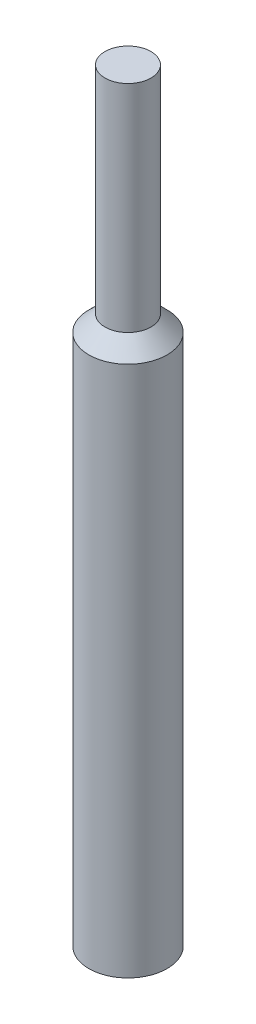
from build123d import *

# Parameters (mm, degrees)
SKETCH1_R           = 6.35
BOSS_EXTRUDE1_DEPTH = 421.64
SKETCH2_R           = 10.795
BOSS_EXTRUDE2_DEPTH = 421.64
SKETCH3_R           = 25.4
SKETCH3_R_2         = 6.35
CUT_EXTRUDE1_DEPTH  = 52.324
CUT_EXTRUDE2_START  = -57.658
SKETCH4_R           = 25.4
SKETCH4_R_2         = 6.35
CUT_EXTRUDE2_DEPTH  = 57.658
CHAMFER1_SIZE       = 6.35
SKETCH5_R           = 15.875
CUT_EXTRUDE3_DEPTH  = 212.372033273
CUT_EXTRUDE4_DEPTH  = 19.304


with BuildPart() as part:
    # Sketch1 → Boss-Extrude1 (new body)
    with BuildSketch(Plane(origin=(0, 0, 0), x_dir=(1, 0, 0), z_dir=(0, 1, 0))):
        with Locations(Location((0, 0, 0), (0, 0, 270))):
            Circle(SKETCH1_R)
    extrude(amount=BOSS_EXTRUDE1_DEPTH)

    # Sketch2 → Boss-Extrude2 (add)
    with BuildSketch(Plane(origin=(0, 0, 0), x_dir=(-1, 0, 0), z_dir=(0, -1, 0))):
        with Locations(Location((0, 0, 0), (0, 0, 90))):
            Circle(SKETCH2_R)
    extrude(amount=-BOSS_EXTRUDE2_DEPTH)

    # Sketch3 → Cut-Extrude1 (cut)
    with BuildSketch(Plane.XZ):
        Circle(SKETCH3_R)
        with Locations(Location((0, 0, 0), (0, 0, 270))):
            Circle(SKETCH3_R_2, mode=Mode.SUBTRACT)
    extrude(amount=-CUT_EXTRUDE1_DEPTH, mode=Mode.SUBTRACT)

    # Sketch4 → Cut-Extrude2 (cut)
    with BuildSketch(Plane(origin=(0, 421.64, 0), x_dir=(1, 0, 0), z_dir=(0, 1, 0)).offset(CUT_EXTRUDE2_START)):
        Circle(SKETCH4_R)
        with Locations(Location((0, 0, 0), (0, 0, 90))):
            Circle(SKETCH4_R_2, mode=Mode.SUBTRACT)
    extrude(amount=CUT_EXTRUDE2_DEPTH, mode=Mode.SUBTRACT)

    # Chamfer1
    # the kernel refuses this chamfer: 6.35 mm, written as the material it takes off along each edge
    with BuildSketch(Plane(origin=(0, 52.324, 0), x_dir=(0, 0, -1), z_dir=(-1, 0, 0))) as chamfer1_piece_1_section:
        Polygon((10.795, -CHAMFER1_SIZE), (10.795 - CHAMFER1_SIZE, 0), (10.795, 0), align=None)
    chamfer1_piece_1 = revolve(axis=Axis((0, 52.324, 0), (0, -1, 0)), mode=Mode.PRIVATE)
    chamfer1_piece_1 = chamfer1_piece_1 - Plane(origin=(0, 56.4676015, 0), x_dir=(0, 0, -1), z_dir=(0, -1, 0)) * Cylinder(6.35, 44, mode=Mode.PRIVATE)
    add(chamfer1_piece_1, mode=Mode.SUBTRACT)
    with BuildSketch(Plane(origin=(0, 363.982, 0), x_dir=(0, 0, -1), z_dir=(-1, 0, 0))) as chamfer1_piece_2_section:
        Polygon((10.795, CHAMFER1_SIZE), (10.795 - CHAMFER1_SIZE, 0), (10.795, 0), align=None)
    chamfer1_piece_2 = revolve(axis=Axis((0, 363.982, 0), (0, -1, 0)), mode=Mode.PRIVATE)
    chamfer1_piece_2 = chamfer1_piece_2 - Plane(origin=(0, 359.8383985, 0), x_dir=(0, 0, -1), z_dir=(0, -1, 0)) * Cylinder(6.35, 44, mode=Mode.PRIVATE)
    add(chamfer1_piece_2, mode=Mode.SUBTRACT)

    # Sketch5 → Cut-Extrude3 (cut, through all)
    with BuildSketch(Plane(origin=(0, 210.82, 0), x_dir=(1, 0, 0), z_dir=(0, 1, 0))):
        Circle(SKETCH5_R)
    extrude(amount=-CUT_EXTRUDE3_DEPTH, mode=Mode.SUBTRACT)

    # Sketch6 → Cut-Extrude4 (cut)
    with BuildSketch(Plane(origin=(0, 210.82, 0), x_dir=(-1, 0, 0), z_dir=(0, -1, 0))):
        Polygon((-5.054761839, -3.255740788), (0.292173311, -6.005422557), (5.346935151, -2.749681769), (5.054761839, 3.255740788), (-0.292173311, 6.005422557), (-5.346935151, 2.749681769), align=None)
    extrude(amount=-CUT_EXTRUDE4_DEPTH, mode=Mode.SUBTRACT)


solid = part.part
